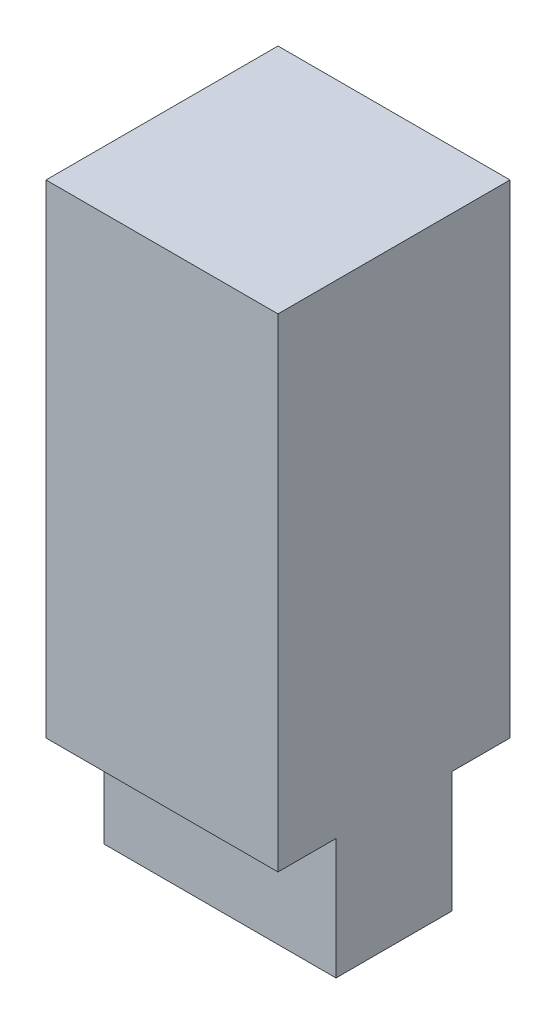
from build123d import *

# Parameters (mm, degrees)
BOSS_EXTRUDE1_DEPTH = 6.096


with BuildPart() as part:
    # Sketch2 → Boss-Extrude1 (new body)
    with BuildSketch(Plane(origin=(0, 0, 0), x_dir=(0, 0, -1), z_dir=(1, 0, 0))):
        Polygon((0, 0), (-1.524, 0), (-1.524, 3.175), (-3.048, 3.175), (-3.048, 15.875), (3.048, 15.875), (3.048, 3.175), (1.524, 3.175), (1.524, 0), align=None)
    extrude(amount=BOSS_EXTRUDE1_DEPTH)


solid = part.part
